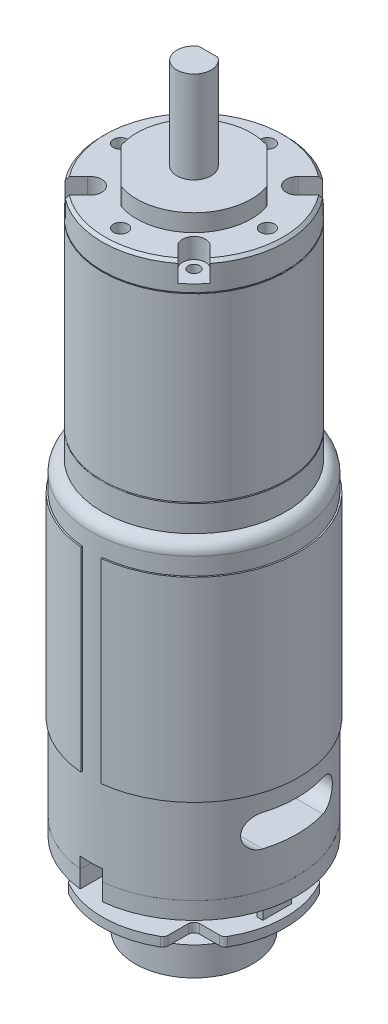
from build123d import *

# Parameters (mm, degrees)
CROQUIS1_R               = 10.25
SALIENTE_EXTRUIR1_DEPTH  = 5
CROQUIS2_R               = 2.5
SALIENTE_EXTRUIR2_DEPTH  = 3.37
SALIENTE_EXTRUIR3_DEPTH  = 1.6
CROQUIS4_R               = 7.5
SALIENTE_EXTRUIR4_DEPTH  = 4.2
SALIENTE_EXTRUIR5_DEPTH  = 3
CROQUIS6_R               = 18
SALIENTE_EXTRUIR6_DEPTH  = 54
CORTAR_EXTRUIR1_DEPTH    = 2
REDONDEO1_R              = 2
CROQUIS9_R               = 16
SALIENTE_EXTRUIR7_DEPTH  = 4.73
REDONDEO2_R              = 0.2
CROQUIS10_R              = 16
SALIENTE_EXTRUIR8_DEPTH  = 31.5
CROQUIS11_R              = 16
SALIENTE_EXTRUIR9_DEPTH  = 5
REDONDEO3_R              = 0.2
CHAFL_N1_SIZE            = 0.5
CROQUIS12_R              = 1.25
CORTAR_EXTRUIR2_DEPTH    = 5.5
CROQUIS13_R              = 1
CORTAR_EXTRUIR4_DEPTH    = 8.9
CROQUIS14_R              = 1
CORTAR_EXTRUIR5_DEPTH    = 3.5
SALIENTE_EXTRUIR10_DEPTH = 3
CROQUIS16_R              = 3
SALIENTE_EXTRUIR11_DEPTH = 16
CORTAR_EXTRUIR6_DEPTH    = 12
CROQUIS18_R              = 6
CORTAR_EXTRUIR8_DEPTH    = 0.25
CROQUIS19_R              = 1.5
CORTAR_EXTRUIR9_DEPTH    = 0.5
CROQUIS20_R              = 1.5
CORTAR_EXTRUIR10_DEPTH   = 0.1
SALIENTE_EXTRUIR12_DEPTH = 34
CORTAR_EXTRUIR11_DEPTH   = 22
CROQUIS23_W              = 1
CROQUIS23_H              = 5
SALIENTE_EXTRUIR13_DEPTH = 7
REDONDEO4_R              = 0.5


with BuildPart() as part:
    # Croquis1 → Saliente-Extruir1 (new body)
    with BuildSketch(Plane(origin=(0, 0, 0), x_dir=(1, 0, 0), z_dir=(0, 1, 0))):
        with Locations(Location((0, 0, 0), (0, 0, 270))):
            Circle(CROQUIS1_R)
    extrude(amount=SALIENTE_EXTRUIR1_DEPTH)

    # Croquis2 → Saliente-Extruir2 (add)
    with BuildSketch(Plane(origin=(0, 5, 0), x_dir=(1, 0, 0), z_dir=(0, 1, 0))):
        with Locations(Location((0, 0, 0), (0, 0, 270))):
            Circle(CROQUIS2_R)
    extrude(amount=SALIENTE_EXTRUIR2_DEPTH)

    # Croquis18 → Cortar-Extruir8 (cut)
    with BuildSketch(Plane.XZ):
        with Locations(Location((0, 0, 0), (0, 0, 270))):
            Circle(CROQUIS18_R)
    extrude(amount=-CORTAR_EXTRUIR8_DEPTH, mode=Mode.SUBTRACT)

    # Croquis19 → Cortar-Extruir9 (cut)
    with BuildSketch(Plane.XZ.offset(-0.25)):
        with Locations(Location((0, 0, 0), (0, 0, 270))):
            Circle(CROQUIS19_R)
    extrude(amount=-CORTAR_EXTRUIR9_DEPTH, mode=Mode.SUBTRACT)

    # Croquis20 → Cortar-Extruir10 (cut)
    with BuildSketch(Plane.XZ):
        with Locations(Location((0, 8, 0), (0, 0, 270))):
            Circle(CROQUIS20_R)
        with Locations(Location((8, 0, 0), (0, 0, 270))):
            Circle(CROQUIS20_R)
        with Locations(Location((0, -8, 0), (0, 0, 270))):
            Circle(CROQUIS20_R)
        with Locations(Location((-8, 0, 0), (0, 0, 270))):
            Circle(CROQUIS20_R)
    extrude(amount=-CORTAR_EXTRUIR10_DEPTH, mode=Mode.SUBTRACT)


with BuildPart() as body_2:
    # Croquis3 → Saliente-Extruir3 (new body)
    with BuildSketch(Plane(origin=(0, 8.37, 0), x_dir=(1, 0, 0), z_dir=(0, 1, 0))):
        with BuildLine():
            Line((8.5, 9.5), (8.5, 12.990381057))
            ThreePointArc((8.5, 12.990381057), (8.366025404, 13.490381057), (8, 13.856406461))
            ThreePointArc((8, 13.856406461), (0, 16), (-8, 13.856406461))
            ThreePointArc((-8, 13.856406461), (-8.366025404, 13.490381057), (-8.5, 12.990381057))
            Line((-8.5, 12.990381057), (-8.5, 9.5))
            ThreePointArc((-8.5, 9.5), (-8.792893219, 8.792893219), (-9.5, 8.5))
            Line((-9.5, 8.5), (-12.990381057, 8.5))
            ThreePointArc((-12.990381057, 8.5), (-13.490381057, 8.366025404), (-13.856406461, 8))
            ThreePointArc((-13.856406461, 8), (-16, 0), (-13.856406461, -8))
            ThreePointArc((-13.856406461, -8), (-13.490381057, -8.366025404), (-12.990381057, -8.5))
            Line((-12.990381057, -8.5), (-9.5, -8.5))
            ThreePointArc((-9.5, -8.5), (-8.792893219, -8.792893219), (-8.5, -9.5))
            Line((-8.5, -9.5), (-8.5, -12.990381057))
            ThreePointArc((-8.5, -12.990381057), (-8.366025404, -13.490381057), (-8, -13.856406461))
            ThreePointArc((-8, -13.856406461), (0, -16), (8, -13.856406461))
            ThreePointArc((8, -13.856406461), (8.366025404, -13.490381057), (8.5, -12.990381057))
            Line((8.5, -12.990381057), (8.5, -9.5))
            ThreePointArc((8.5, -9.5), (8.792893219, -8.792893219), (9.5, -8.5))
            Line((9.5, -8.5), (12.990381057, -8.5))
            ThreePointArc((12.990381057, -8.5), (13.490381057, -8.366025404), (13.856406461, -8))
            ThreePointArc((13.856406461, -8), (16, 0), (13.856406461, 8))
            ThreePointArc((13.856406461, 8), (13.490381057, 8.366025404), (12.990381057, 8.5))
            Line((12.990381057, 8.5), (9.5, 8.5))
            ThreePointArc((9.5, 8.5), (8.792893219, 8.792893219), (8.5, 9.5))
        make_face()
    extrude(amount=SALIENTE_EXTRUIR3_DEPTH)


with BuildPart() as body_3:
    # Croquis4 → Saliente-Extruir4 (new body)
    with BuildSketch(Plane(origin=(0, 9.97, 0), x_dir=(1, 0, 0), z_dir=(0, 1, 0))):
        with Locations(Location((0, 0, 0), (0, 0, 270))):
            Circle(CROQUIS4_R)
    extrude(amount=SALIENTE_EXTRUIR4_DEPTH)


with BuildPart() as body_4:
    # Croquis5 → Saliente-Extruir5 (new body)
    with BuildSketch(Plane(origin=(0, 14.17, 0), x_dir=(1, 0, 0), z_dir=(0, 1, 0))):
        with BuildLine():
            Line((-1.946283854, 17.894467837), (-1.946283854, 13.394467837))
            Line((-1.946283854, 13.394467837), (1.951843027, 13.394467837))
            Line((1.951843027, 13.394467837), (1.946283854, 17.894467837))
            ThreePointArc((1.946283854, 17.894467837), (7.55236123, 16.338966915), (12.369457259, 13.076564041))
            Line((12.369457259, 13.076564041), (11.66726189, 12.374368671))
            Line((11.66726189, 12.374368671), (12.374368671, 11.66726189))
            Line((12.374368671, 11.66726189), (13.076564041, 12.369457259))
            ThreePointArc((13.076564041, 12.369457259), (16.893720143, -6.213068463), (1.946283854, -17.894467837))
            Line((1.946283854, -17.894467837), (1.951843027, -13.394467837))
            Line((1.951843027, -13.394467837), (-1.946283854, -13.394467837))
            Line((-1.946283854, -13.394467837), (-1.946283854, -17.894467837))
            ThreePointArc((-1.946283854, -17.894467837), (-7.55236123, -16.338966915), (-12.369457259, -13.076564041))
            Line((-12.369457259, -13.076564041), (-11.66726189, -12.374368671))
            Line((-11.66726189, -12.374368671), (-12.374368671, -11.66726189))
            Line((-12.374368671, -11.66726189), (-13.076564041, -12.369457259))
            ThreePointArc((-13.076564041, -12.369457259), (-16.893720143, 6.213068463), (-1.946283854, 17.894467837))
        make_face()
    extrude(amount=SALIENTE_EXTRUIR5_DEPTH)

    # Croquis23 → Saliente-Extruir13 (add)
    with BuildSketch(Plane.XZ.offset(-14.17)):
        with Locations((14, 0)):
            Rectangle(CROQUIS23_W, CROQUIS23_H)
        with Locations((-14, 0)):
            Rectangle(CROQUIS23_W, CROQUIS23_H)
    extrude(amount=SALIENTE_EXTRUIR13_DEPTH)

    # Redondeo4
    redondeo4_edges = [body_4.edges().sort_by_distance(p)[0] for p in [
        (14, 7.17, -2.5),
        (14, 7.17, 2.5),
        (-14, 7.17, -2.5),
        (-14, 7.17, 2.5),
    ]]
    fillet(redondeo4_edges, radius=REDONDEO4_R)


with BuildPart() as body_5:
    # Croquis6 → Saliente-Extruir6 (new body)
    with BuildSketch(Plane(origin=(0, 17.17, 0), x_dir=(1, 0, 0), z_dir=(0, 1, 0))):
        with Locations(Location((0, 0, 0), (0, 0, 270))):
            Circle(CROQUIS6_R)
    extrude(amount=SALIENTE_EXTRUIR6_DEPTH)

    # Croquis8 → Cortar-Extruir1 (cut)
    with BuildSketch(Plane.XZ.offset(-17.17)):
        with BuildLine():
            Line((1.951843027, -13.394467837), (1.946283854, -17.894467837))
            ThreePointArc((1.946283854, -17.894467837), (0, -18), (-1.946283854, -17.894467837))
            Line((-1.946283854, -17.894467837), (-1.946283854, -13.394467837))
            Line((-1.946283854, -13.394467837), (1.951843027, -13.394467837))
        make_face()
        with BuildLine():
            Line((-1.946283854, 17.894467837), (-1.946283854, 13.394467837))
            Line((-1.946283854, 13.394467837), (1.951843027, 13.394467837))
            Line((1.951843027, 13.394467837), (1.946283854, 17.894467837))
            ThreePointArc((1.946283854, 17.894467837), (0, 18), (-1.946283854, 17.894467837))
        make_face()
    extrude(amount=-CORTAR_EXTRUIR1_DEPTH, mode=Mode.SUBTRACT)

    # Redondeo1
    redondeo1_edges = [body_5.edges().sort_by_distance(p)[0] for p in [
        (0, 71.17, -18),
    ]]
    fillet(redondeo1_edges, radius=REDONDEO1_R)

    # Croquis9 → Saliente-Extruir7 (add)
    with BuildSketch(Plane(origin=(0, 71.17, 0), x_dir=(1, 0, 0), z_dir=(0, 1, 0))):
        with Locations(Location((0, 0, 0), (0, 0, 90))):
            Circle(CROQUIS9_R)
    extrude(amount=SALIENTE_EXTRUIR7_DEPTH)

    # Redondeo2
    redondeo2_edges = [body_5.edges().sort_by_distance(p)[0] for p in [
        (0, 75.9, 16),
    ]]
    fillet(redondeo2_edges, radius=REDONDEO2_R)

    # Croquis21 → Saliente-Extruir12 (add)
    with BuildSketch(Plane(origin=(0, 32.17, 0), x_dir=(-1, 0, 0), z_dir=(0, -1, 0))):
        with BuildLine():
            Line((-1.946283854, -17.894467837), (-1.946283854, -18.145921833))
            ThreePointArc((-1.946283854, -18.145921833), (0.197192644, 18.248934628), (1.553716146, -18.183741808))
            Line((1.553716146, -18.183741808), (1.553716146, -17.932818131))
            ThreePointArc((1.553716146, -17.932818131), (0.197218249, 17.99891955), (-1.946283854, -17.894467837))
        make_face()
    extrude(amount=-SALIENTE_EXTRUIR12_DEPTH)

    # Croquis22 → Cortar-Extruir11 (cut, symmetric)
    with BuildSketch(Plane(origin=(0, 0, 0), x_dir=(0, 0, -1), z_dir=(1, 0, 0))):
        with BuildLine():
            Line((-5.25, 29), (5.25, 29))
            ThreePointArc((5.25, 29), (8, 26.25), (5.25, 23.5))
            Line((5.25, 23.5), (-5.25, 23.5))
            ThreePointArc((-5.25, 23.5), (-8, 26.25), (-5.25, 29))
        make_face()
    extrude(amount=CORTAR_EXTRUIR11_DEPTH, both=True, mode=Mode.SUBTRACT)


with BuildPart() as body_6:
    # Croquis10 → Saliente-Extruir8 (new body)
    with BuildSketch(Plane(origin=(0, 75.9, 0), x_dir=(1, 0, 0), z_dir=(0, 1, 0))):
        with Locations(Location((0, 0, 0), (0, 0, 270))):
            Circle(CROQUIS10_R)
    extrude(amount=SALIENTE_EXTRUIR8_DEPTH)


with BuildPart() as body_7:
    # Croquis11 → Saliente-Extruir9 (new body)
    with BuildSketch(Plane(origin=(0, 107.4, 0), x_dir=(1, 0, 0), z_dir=(0, 1, 0))):
        with Locations(Location((0, 0, 0), (0, 0, 270))):
            Circle(CROQUIS11_R)
    extrude(amount=SALIENTE_EXTRUIR9_DEPTH)

    # Redondeo3
    redondeo3_edges = [body_7.edges().sort_by_distance(p)[0] for p in [
        (0, 107.4, -16),
    ]]
    fillet(redondeo3_edges, radius=REDONDEO3_R)

    # Chaflán1
    chafl_n1_edges = [body_7.edges().sort_by_distance(p)[0] for p in [
        (0, 112.4, -16),
    ]]
    chamfer(chafl_n1_edges, length=CHAFL_N1_SIZE)

    # Croquis12 → Cortar-Extruir2 (cut)
    with BuildSketch(Plane(origin=(0, 112.4, 0), x_dir=(1, 0, 0), z_dir=(0, 1, 0))):
        with Locations(Location((0, 12.8, 0), (0, 0, 270))):
            Circle(CROQUIS12_R)
        with Locations(Location((12.8, 0, 0), (0, 0, 270))):
            Circle(CROQUIS12_R)
        with Locations(Location((0, -12.8, 0), (0, 0, 270))):
            Circle(CROQUIS12_R)
        with Locations(Location((-12.8, 0, 0), (0, 0, 270))):
            Circle(CROQUIS12_R)
    extrude(amount=-CORTAR_EXTRUIR2_DEPTH, mode=Mode.SUBTRACT)

    # Croquis13 → Cortar-Extruir4 (cut)
    with BuildSketch(Plane(origin=(0, 112.4, 0), x_dir=(1, 0, 0), z_dir=(0, 1, 0))):
        with Locations(Location((9.050966799, 9.050966799, 0), (0, 0, 270))):
            Circle(CROQUIS13_R)
        with Locations(Location((9.050966799, -9.050966799, 0), (0, 0, 270))):
            Circle(CROQUIS13_R)
        with Locations(Location((-9.050966799, -9.050966799, 0), (0, 0, 270))):
            Circle(CROQUIS13_R)
        with Locations(Location((-9.050966799, 9.050966799, 0), (0, 0, 270))):
            Circle(CROQUIS13_R)
    extrude(amount=-CORTAR_EXTRUIR4_DEPTH, mode=Mode.SUBTRACT)

    # Croquis14 → Cortar-Extruir5 (cut)
    # profile 1 of 8: a face of its own
    with BuildSketch(Plane(origin=(0, 112.4, 0), x_dir=(1, 0, 0), z_dir=(0, 1, 0))):
        with BuildLine():
            Line((-7.896490117, 10.684118229), (-9.477353424, 12.264981536))
            ThreePointArc((-9.477353424, 12.264981536), (-10.97043477, 10.949865796), (-12.282746122, 9.454318997))
            Line((-12.282746122, 9.454318997), (-10.465180362, 7.636753237))
            ThreePointArc((-10.465180362, 7.636753237), (-7.521759763, 7.761964922), (-7.896490117, 10.684118229))
        make_face()
        with Locations(Location((-9.050966799, 9.050966799, 0), (0, 0, 270))):
            Circle(CROQUIS14_R, mode=Mode.SUBTRACT)
    # profile 2 of 8: a face of its own
    with BuildSketch(Plane(origin=(0, 112.4, 0), x_dir=(1, 0, 0), z_dir=(0, 1, 0))):
        with BuildLine():
            Line((-10.684118228, -7.896490117), (-12.264981536, -9.477353424))
            ThreePointArc((-12.264981536, -9.477353424), (-10.949865796, -10.97043477), (-9.454318997, -12.282746122))
            Line((-9.454318997, -12.282746122), (-7.636753237, -10.465180362))
            ThreePointArc((-7.636753237, -10.465180362), (-7.761964922, -7.521759763), (-10.684118228, -7.896490117))
        make_face()
        with Locations(Location((-9.050966799, -9.050966799, 0), (0, 0, 270))):
            Circle(CROQUIS14_R, mode=Mode.SUBTRACT)
    # profile 3 of 8: a face of its own
    with BuildSketch(Plane(origin=(0, 112.4, 0), x_dir=(1, 0, 0), z_dir=(0, 1, 0))):
        with BuildLine():
            Line((9.454318997, 12.282746122), (7.636753237, 10.465180362))
            ThreePointArc((7.636753237, 10.465180362), (7.761964922, 7.521759763), (10.684118229, 7.896490117))
            Line((10.684118229, 7.896490117), (12.264981536, 9.477353424))
            ThreePointArc((12.264981536, 9.477353424), (10.949865796, 10.97043477), (9.454318997, 12.282746122))
        make_face()
        with Locations(Location((9.050966799, 9.050966799, 0), (0, 0, 270))):
            Circle(CROQUIS14_R, mode=Mode.SUBTRACT)
    # profile 4 of 8: a face of its own
    with BuildSketch(Plane(origin=(0, 112.4, 0), x_dir=(1, 0, 0), z_dir=(0, 1, 0))):
        with BuildLine():
            ThreePointArc((9.477353424, -12.264981536), (10.97043477, -10.949865796), (12.282746122, -9.454318997))
            Line((12.282746122, -9.454318997), (10.465180362, -7.636753237))
            ThreePointArc((10.465180362, -7.636753237), (7.521759763, -7.761964922), (7.896490117, -10.684118229))
            Line((7.896490117, -10.684118229), (9.477353424, -12.264981536))
        make_face()
        with Locations(Location((9.050966799, -9.050966799, 0), (0, 0, 270))):
            Circle(CROQUIS14_R, mode=Mode.SUBTRACT)
    # profile 5 of 8: a face of its own
    with BuildSketch(Plane(origin=(0, 112.4, 0), x_dir=(1, 0, 0), z_dir=(0, 1, 0))):
        with BuildLine():
            Line((9.810758598, 12.639185723), (9.454318997, 12.282746122))
            ThreePointArc((9.454318997, 12.282746122), (10.949865796, 10.97043477), (12.264981536, 9.477353424))
            Line((12.264981536, 9.477353424), (12.621337486, 9.833709375))
            ThreePointArc((12.621337486, 9.833709375), (11.303424617, 11.323983042), (9.810758598, 12.639185723))
        make_face()
    # profile 6 of 8: a face of its own
    with BuildSketch(Plane(origin=(0, 112.4, 0), x_dir=(1, 0, 0), z_dir=(0, 1, 0))):
        with BuildLine():
            ThreePointArc((-12.282746122, 9.454318997), (-10.97043477, 10.949865796), (-9.477353424, 12.264981536))
            Line((-9.477353424, 12.264981536), (-9.833709375, 12.621337486))
            ThreePointArc((-9.833709375, 12.621337486), (-11.323983042, 11.303424617), (-12.639185723, 9.810758598))
            Line((-12.639185723, 9.810758598), (-12.282746122, 9.454318997))
        make_face()
    # profile 7 of 8: a face of its own
    with BuildSketch(Plane(origin=(0, 112.4, 0), x_dir=(1, 0, 0), z_dir=(0, 1, 0))):
        with BuildLine():
            ThreePointArc((-9.454318997, -12.282746122), (-10.949865796, -10.97043477), (-12.264981536, -9.477353424))
            Line((-12.264981536, -9.477353424), (-12.621337486, -9.833709375))
            ThreePointArc((-12.621337486, -9.833709375), (-11.303424617, -11.323983042), (-9.810758598, -12.639185723))
            Line((-9.810758598, -12.639185723), (-9.454318997, -12.282746122))
        make_face()
    # profile 8 of 8: a face of its own
    with BuildSketch(Plane(origin=(0, 112.4, 0), x_dir=(1, 0, 0), z_dir=(0, 1, 0))):
        with BuildLine():
            Line((12.639185723, -9.810758598), (12.282746122, -9.454318997))
            ThreePointArc((12.282746122, -9.454318997), (10.97043477, -10.949865796), (9.477353424, -12.264981536))
            Line((9.477353424, -12.264981536), (9.833709375, -12.621337486))
            ThreePointArc((9.833709375, -12.621337486), (11.323983042, -11.303424617), (12.639185723, -9.810758598))
        make_face()
    extrude(amount=-CORTAR_EXTRUIR5_DEPTH, mode=Mode.SUBTRACT)

    # Croquis15 → Saliente-Extruir10 (add)
    with BuildSketch(Plane(origin=(0, 112.4, 0), x_dir=(1, 0, 0), z_dir=(0, 1, 0))):
        with BuildLine():
            Line((3.448485083, 9.279436978), (9.279436978, 3.448485083))
            ThreePointArc((9.279436978, 3.448485083), (9.426181135, 3.261895906), (9.52481133, 3.045975891))
            ThreePointArc((9.52481133, 3.045975891), (7.071067812, -7.071067812), (-3.045975891, -9.52481133))
            ThreePointArc((-3.045975891, -9.52481133), (-3.261895906, -9.426181135), (-3.448485083, -9.279436978))
            Line((-3.448485083, -9.279436978), (-9.279436978, -3.448485083))
            ThreePointArc((-9.279436978, -3.448485083), (-9.426181135, -3.261895906), (-9.52481133, -3.045975891))
            ThreePointArc((-9.52481133, -3.045975891), (-7.071067812, 7.071067812), (3.045975891, 9.52481133))
            ThreePointArc((3.045975891, 9.52481133), (3.261895906, 9.426181135), (3.448485083, 9.279436978))
        make_face()
    extrude(amount=SALIENTE_EXTRUIR10_DEPTH)

    # Croquis16 → Saliente-Extruir11 (add)
    with BuildSketch(Plane(origin=(0, 115.4, 0), x_dir=(1, 0, 0), z_dir=(0, 1, 0))):
        with Locations(Location((0, 0, 0), (0, 0, 270))):
            Circle(CROQUIS16_R)
    extrude(amount=SALIENTE_EXTRUIR11_DEPTH)

    # Croquis17 → Cortar-Extruir6 (cut)
    with BuildSketch(Plane(origin=(0, 131.4, 0), x_dir=(1, 0, 0), z_dir=(0, 1, 0))):
        with BuildLine():
            Line((-1.658312395, 2.5), (1.658312395, 2.5))
            ThreePointArc((1.658312395, 2.5), (0, 3), (-1.658312395, 2.5))
        make_face()
    extrude(amount=-CORTAR_EXTRUIR6_DEPTH, mode=Mode.SUBTRACT)


solid = Compound([part.part, body_2.part, body_3.part, body_4.part, body_5.part, body_6.part, body_7.part])
